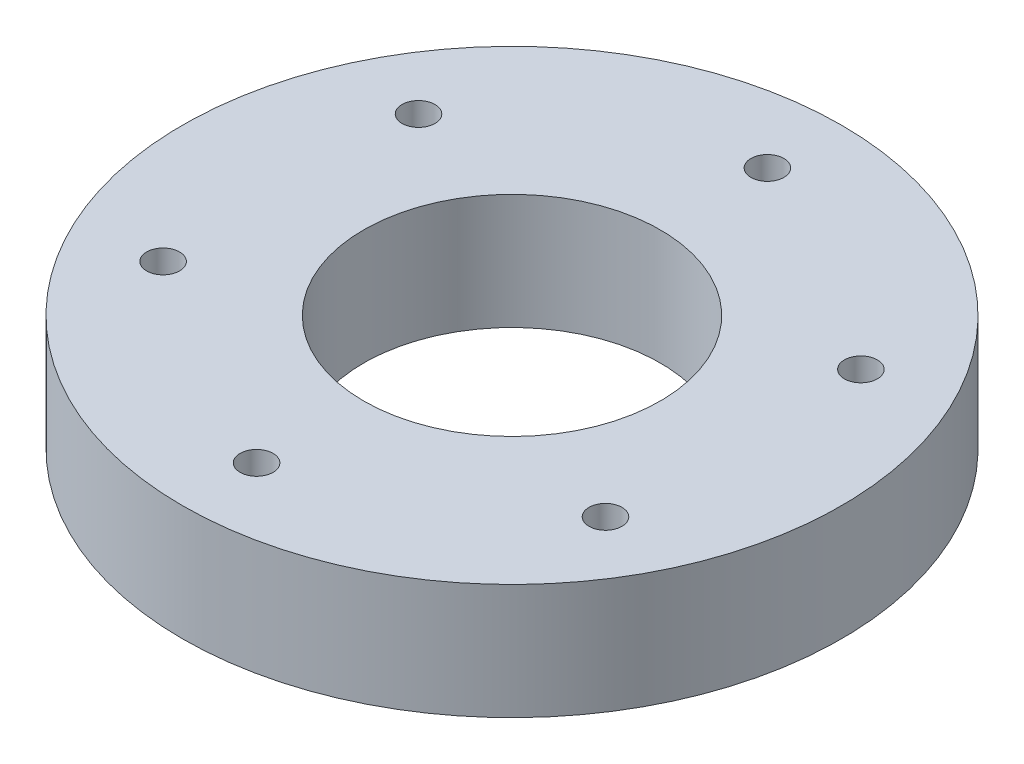
from build123d import *

# Parameters (mm, degrees)
SKETCH1_R           = 20
SKETCH1_R_2         = 9
SKETCH1_R_3         = 1
BOSS_EXTRUDE1_DEPTH = 7


with BuildPart() as part:
    # Sketch1 → Boss-Extrude1 (new body)
    with BuildSketch(Plane(origin=(0, 0, 0), x_dir=(1, 0, 0), z_dir=(0, 1, 0))):
        Circle(SKETCH1_R)
        Circle(SKETCH1_R_2, mode=Mode.SUBTRACT)
        with Locations((0, 15.5)):
            Circle(SKETCH1_R_3, mode=Mode.SUBTRACT)
        with Locations((13.423393759, 7.75)):
            Circle(SKETCH1_R_3, mode=Mode.SUBTRACT)
        with Locations((13.423393759, -7.75)):
            Circle(SKETCH1_R_3, mode=Mode.SUBTRACT)
        with Locations((0, -15.5)):
            Circle(SKETCH1_R_3, mode=Mode.SUBTRACT)
        with Locations((-13.423393759, -7.75)):
            Circle(SKETCH1_R_3, mode=Mode.SUBTRACT)
        with Locations((-13.423393759, 7.75)):
            Circle(SKETCH1_R_3, mode=Mode.SUBTRACT)
    extrude(amount=BOSS_EXTRUDE1_DEPTH)


solid = part.part
